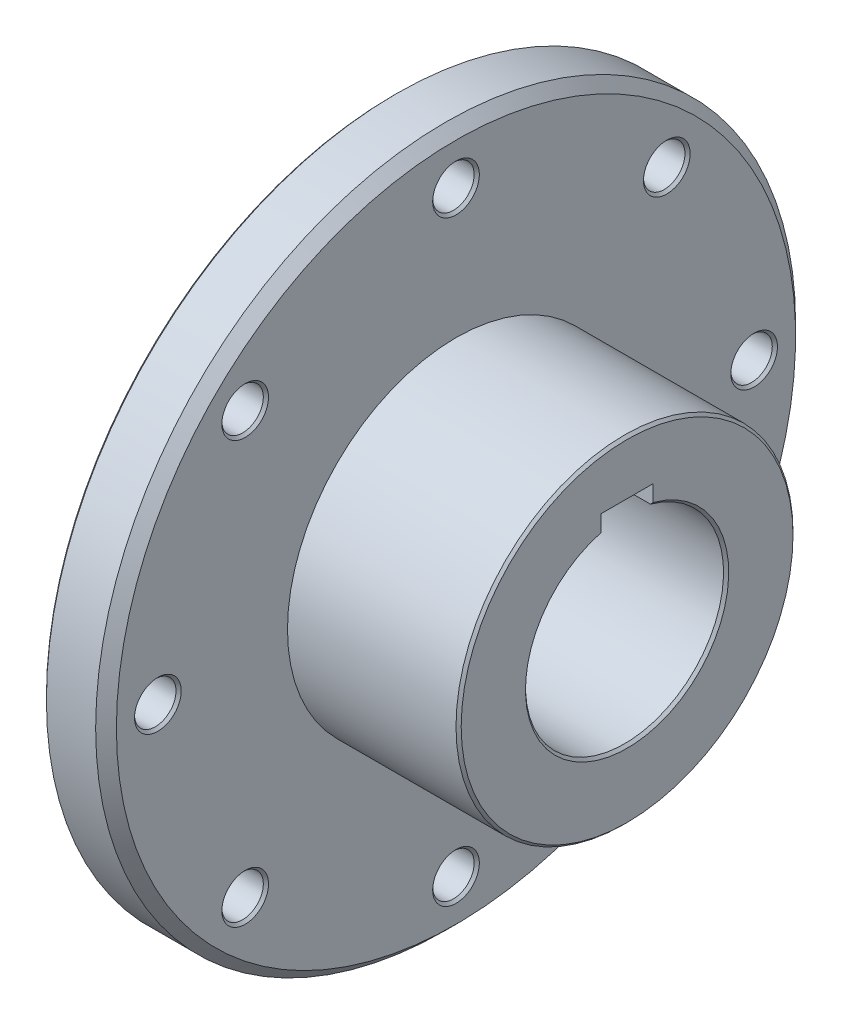
from build123d import *

# Parameters (mm, degrees)
SKETCH_2_W          = 10
SKETCH_2_H          = 22.1
CUT_EXTRUDE_1_DEPTH = 111.170322683
SKETCH_3_R          = 4
CUT_EXTRUDE_2_DEPTH = 102.002475217
CHAMFER_1_SIZE      = 2
CHAMFER_2_SIZE      = 1
CHAMFER_3_SIZE      = 0.5


with BuildPart() as part:
    # 草图1 → 旋转1 (revolve)
    with BuildSketch(Plane.XY):
        Polygon((0, 19.1), (0, 32.5), (10, 32.5), (10, 67.5), (22, 67.5), (22, 32.5), (55, 32.5), (55, 19.1), align=None)
    revolve(axis=Axis((0, 0, 0), (1, 0, 0)))

    # 草图2 → 切除-拉伸1 (cut, through all)
    with BuildSketch(Plane(origin=(55, 0, 0), x_dir=(0, 0, -1), z_dir=(1, 0, 0))):
        with Locations((0, 11.05)):
            Rectangle(SKETCH_2_W, SKETCH_2_H)
    extrude(amount=-CUT_EXTRUDE_1_DEPTH, mode=Mode.SUBTRACT)

    # 草图3 → 切除-拉伸2 (cut, through all)
    with BuildSketch(Plane(origin=(22, 0, 0), x_dir=(0, 0, -1), z_dir=(1, 0, 0))):
        with Locations((0, 57.5)):
            Circle(SKETCH_3_R)
        with Locations((40.658639918, 40.658639918)):
            Circle(SKETCH_3_R)
        with Locations((57.5, 0)):
            Circle(SKETCH_3_R)
        with Locations((40.658639918, -40.658639918)):
            Circle(SKETCH_3_R)
        with Locations((0, -57.5)):
            Circle(SKETCH_3_R)
        with Locations((-40.658639918, -40.658639918)):
            Circle(SKETCH_3_R)
        with Locations((-57.5, 0)):
            Circle(SKETCH_3_R)
        with Locations((-40.658639918, 40.658639918)):
            Circle(SKETCH_3_R)
    extrude(amount=-CUT_EXTRUDE_2_DEPTH, mode=Mode.SUBTRACT)

    # 倒角1
    chamfer_1_edges = [part.edges().sort_by_distance(p)[0] for p in [
        (22, -67.5, 0),
    ]]
    chamfer(chamfer_1_edges, length=CHAMFER_1_SIZE)

    # 倒角2
    chamfer_2_edges = [part.edges().sort_by_distance(p)[0] for p in [
        (0, -19.1, 0),
    ]]
    chamfer(chamfer_2_edges, length=CHAMFER_2_SIZE)

    # 倒角3
    chamfer_3_edges = [part.edges().sort_by_distance(p)[0] for p in [
        (55, -32.5, 0),
        (10, -67.5, 0),
        (10, 40.658639918, 44.658639918),
        (10, 0, 61.5),
        (10, -40.658639918, 44.658639918),
        (10, -57.5, 4),
        (10, -40.658639918, -36.658639918),
        (10, 0, -53.5),
        (10, 40.658639918, -36.658639918),
        (10, 57.5, 4),
        (22, 40.658639918, 44.658639918),
        (22, 57.5, 4),
        (22, 0, -53.5),
        (22, 40.658639918, -36.658639918),
        (22, -40.658639918, -36.658639918),
        (22, -57.5, 4),
        (22, -40.658639918, 44.658639918),
        (22, 0, 61.5),
        (55, -19.1, 0),
    ]]
    chamfer(chamfer_3_edges, length=CHAMFER_3_SIZE)


solid = part.part
